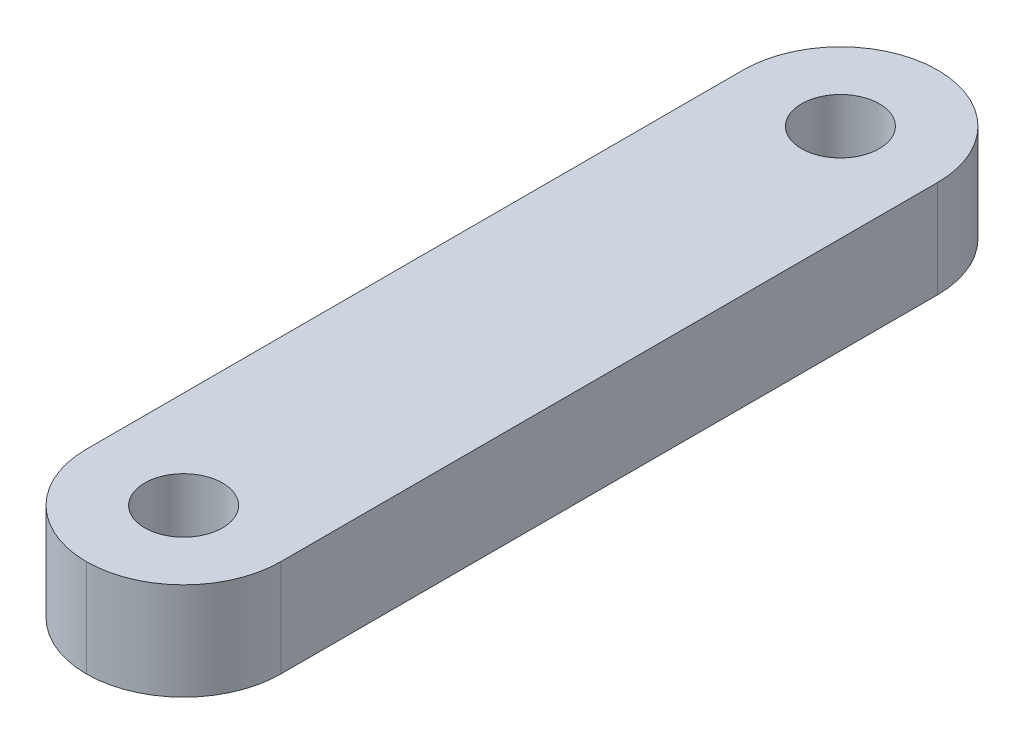
from build123d import *

# Parameters (mm, degrees)
SKETCH1_W           = 8
SKETCH1_H           = 4
BOSS_EXTRUDE1_DEPTH = 35
SKETCH2_R           = 1.6
CUT_EXTRUDE1_DEPTH  = 37.124783736
FILLET1_R           = 4


with BuildPart() as part:
    # Sketch1 → Boss-Extrude1 (new body)
    with BuildSketch(Plane.XY):
        with Locations((4, -2)):
            Rectangle(SKETCH1_W, SKETCH1_H)
    extrude(amount=BOSS_EXTRUDE1_DEPTH)

    # Sketch2 → Cut-Extrude1 (cut, through all)
    with BuildSketch(Plane(origin=(0, 0, 0), x_dir=(1, 0, 0), z_dir=(0, 1, 0))):
        with Locations(Location((4, -4, 0), (0, 0, 270))):
            Circle(SKETCH2_R)
        with Locations(Location((4, -31, 0), (0, 0, 270))):
            Circle(SKETCH2_R)
    extrude(amount=-CUT_EXTRUDE1_DEPTH, mode=Mode.SUBTRACT)

    # Fillet1
    fillet1_edges = [part.edges().sort_by_distance(p)[0] for p in [
        (0, -2, 0),
        (8, -2, 0),
        (0, -2, 35),
        (8, -2, 35),
    ]]
    fillet(fillet1_edges, radius=FILLET1_R - 0.0001)  # a hair under: the kernel refuses the full size


solid = part.part
